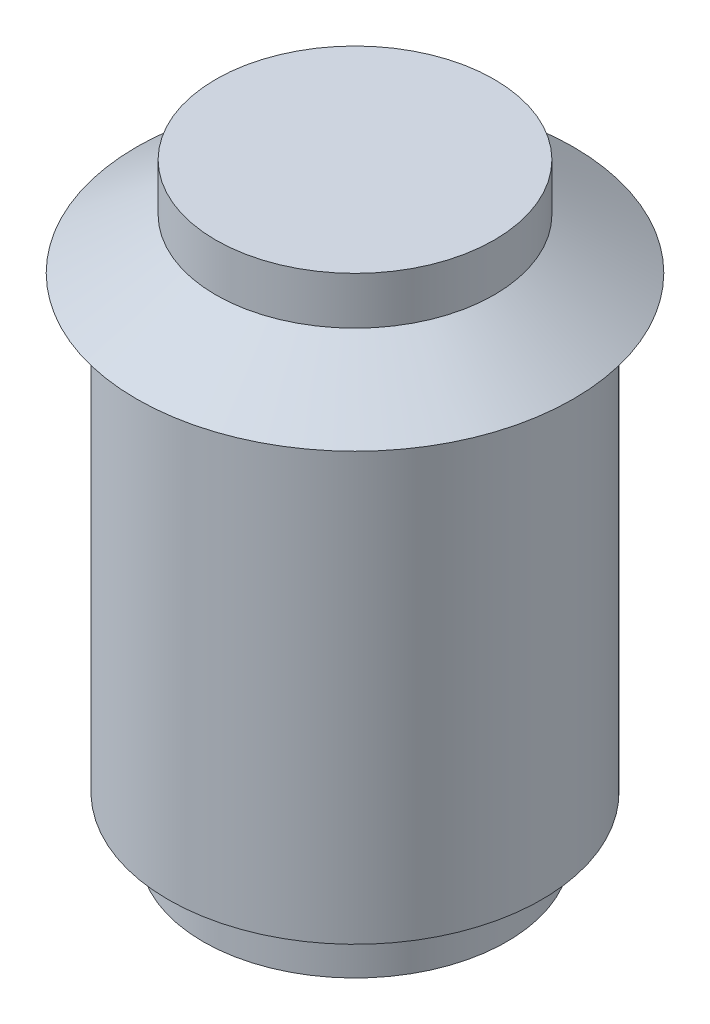
from build123d import *


with BuildPart() as part:
    # Sketch1 → Revolve1 (revolve)
    with BuildSketch(Plane(origin=(0, 0, 0), x_dir=(0, 0, -1), z_dir=(1, 0, 0))):
        Polygon((0, 0), (0, 19), (4.4, 19), (4.4, 17.5), (6.9, 15.9), (5.9, 15.9), (5.9, 1.7), (4.8, 1.7), (4.8, 0), align=None)
    revolve(axis=Axis((0, 0, 0), (0, 1, 0)))


solid = part.part
